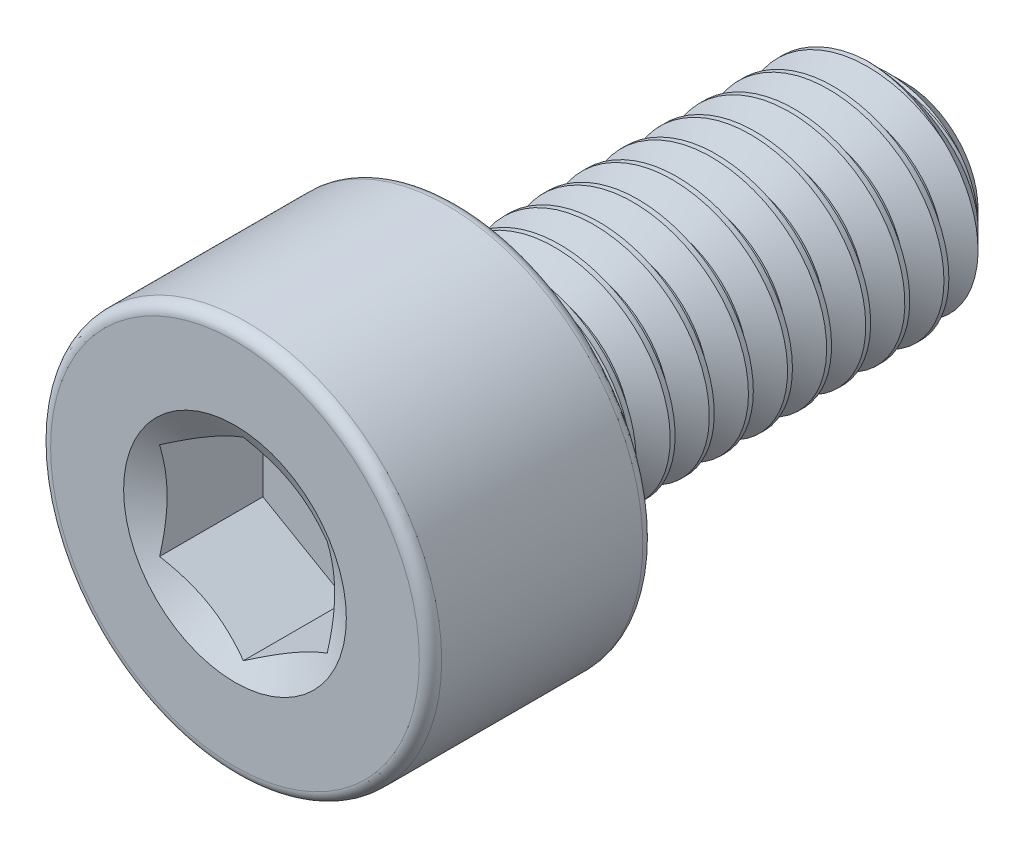
from build123d import *

# Parameters (mm, degrees)
CUT_EXTRUDE1_START            = 6
CUT_EXTRUDE1_DEPTH            = 2
CUT_SWEEP1_PITCH              = 0.7
SKETCH7_R                     = 2.0508
BOSS_EXTRUDE1_DEPTH           = 2.1
BOSS_EXTRUDE1_TAPER           = 20
BOSS_EXTRUDE1_OTHER_WAY_DEPTH = 0.4


# Read off the part's stored shape, not the designer's step: Split1
with BuildPart() as part:
    # Sketch2 → Revolve1 (revolve)
    with BuildSketch(Plane(origin=(0, 0, 0), x_dir=(0, 0, -1), z_dir=(1, 0, 0)), mode=Mode.PRIVATE) as revolve1_sk:
        with BuildLine():
            Line((6, 0), (6, 1.3))
            Line((6, 1.3), (5.3, 2))
            Line((5.3, 2), (-2, 2))
            Line((-2, 2), (-2, 3.3))
            ThreePointArc((-2, 3.3), (-2.058578644, 3.441421356), (-2.2, 3.5))
            Line((-2.2, 3.5), (-5.8, 3.5))
            ThreePointArc((-5.8, 3.5), (-5.941421356, 3.441421356), (-6, 3.3))
            Line((-6, 3.3), (-6, 0))
            Line((-6, 0), (6, 0))
        make_face()
    revolve(revolve1_sk.sketch.rotate(Axis((0, 0, -6), (0, 0, 1)), 90), axis=Axis((0, 0, -6), (0, 0, 1)))

    # Sketch3 → Cut-Extrude1 (cut)
    with BuildSketch(Plane.XY.offset(CUT_EXTRUDE1_START)):
        Polygon((-1.5, 0.866025404), (-1.5, -0.866025404), (0, -1.732050808), (1.5, -0.866025404), (1.5, 0.866025404), (0, 1.732050808), align=None)
    extrude(amount=-CUT_EXTRUDE1_DEPTH, mode=Mode.SUBTRACT)

    # Cut-Extrude2 cone 1 section (through the dimple's axis) → Cut-Extrude2 (revolve, cut)
    with BuildSketch(Plane(origin=(0, 0, 6), x_dir=(0, -1, 0), z_dir=(1, 0, 0))):
        Polygon((0, 0), (1.993375673, 0), (0, 1.150875981), align=None)
    revolve(axis=Axis((0, 0, 6), (0, 0, -1)), mode=Mode.SUBTRACT)


with BuildPart() as body_2:
    # Split1: the piece on the far side of the plane
    add(part.part)
    split(bisect_by=Plane.XY.offset(2), keep=Keep.BOTTOM)

    # Cut-Sweep1: the profile of Sketch5 screwed along a right-hand helix of 12.428571 turns, 6 arcs to a turn; built about Z, then put on its axis
    cut_sweep1_z = Axis((0, 0, 0), (0, 0, 1))
    cut_sweep1_corners = [(1.545336663, 0, -0.2625), (1.545336663, 0, -0.35), (2.037888611, 0, -0.634375), (2.037888611, 0, 0.021875)]
    with BuildLine(mode=Mode.PRIVATE) as cut_sweep1_profile:
        Line(cut_sweep1_corners[0], cut_sweep1_corners[1])
        Line(cut_sweep1_corners[1], cut_sweep1_corners[2])
        Line(cut_sweep1_corners[2], cut_sweep1_corners[3])
        Line(cut_sweep1_corners[3], cut_sweep1_corners[0])
    cut_sweep1_cap = Face(cut_sweep1_profile.wire())
    cut_sweep1_turn_angles = [0, 30, 60, 90, 120, 150, 180, 210, 240, 270, 300, 330, 360]
    cut_sweep1_turn_weights = [1, 0.8660254037844387, 1, 0.8660254037844387, 1, 0.8660254037844387, 1, 0.8660254037844387, 1, 0.8660254037844387, 1, 0.8660254037844387, 1]
    cut_sweep1_turn_rails = [Edge.make_bspline([Vector(p[0], p[1], 0).rotate(cut_sweep1_z, cut_sweep1_turn_angles[k]) / cut_sweep1_turn_weights[k] + Vector(0, 0, p[2] + CUT_SWEEP1_PITCH * cut_sweep1_turn_angles[k] / 360) for k in range(13)], [0, 0, 0, 1, 1, 2, 2, 3, 3, 4, 4, 5, 5, 6, 6, 6], 2, cut_sweep1_turn_weights) for p in cut_sweep1_corners]
    cut_sweep1_turn_sides = [Face.make_surface_from_curves(cut_sweep1_turn_rails[p[0]], cut_sweep1_turn_rails[p[1]]) for p in [(0, 1), (1, 2), (2, 3), (3, 0)]]
    cut_sweep1_last_angles = [4320, 4350, 4380, 4410, 4440, 4457.142857143, 4474.285714286]
    cut_sweep1_last_weights = [1, 0.8660254037844387, 1, 0.8660254037844387, 1, 0.9555728057861514, 1]
    cut_sweep1_last_rails = [Edge.make_bspline([Vector(p[0], p[1], 0).rotate(cut_sweep1_z, cut_sweep1_last_angles[k]) / cut_sweep1_last_weights[k] + Vector(0, 0, p[2] + CUT_SWEEP1_PITCH * cut_sweep1_last_angles[k] / 360) for k in range(7)], [0, 0, 0, 1, 1, 2, 2, 3, 3, 3], 2, cut_sweep1_last_weights) for p in cut_sweep1_corners]
    cut_sweep1_last_sides = [Face.make_surface_from_curves(cut_sweep1_last_rails[p[0]], cut_sweep1_last_rails[p[1]]) for p in [(0, 1), (1, 2), (2, 3), (3, 0)]]
    cut_sweep1 = Plane(origin=(0, 0, -6), x_dir=(0, 1, 0), z_dir=(0, 0, 1)) * Solid(Shell([*[p.moved(Location((0, 0, CUT_SWEEP1_PITCH * i))) for i in range(12) for p in cut_sweep1_turn_sides], *cut_sweep1_last_sides, cut_sweep1_cap, cut_sweep1_cap.rotate(cut_sweep1_z, 4474.285714286).moved(Location((0, 0, CUT_SWEEP1_PITCH * 4474.285714286 / 360)))]))
    add(cut_sweep1, mode=Mode.SUBTRACT)


with BuildPart() as part_1:
    add(part.part)

    # Split1
    split(bisect_by=Plane.XY.offset(2), keep=Keep.TOP)

    add(body_2.part)  # Boss-Extrude1 merges body 2
    # Sketch7 → Boss-Extrude1 (add)
    with BuildSketch(Plane(origin=(0, 0, 2), x_dir=(-1, 0, 0), z_dir=(0, 0, -1))):
        Circle(SKETCH7_R)
    extrude(amount=BOSS_EXTRUDE1_DEPTH, taper=BOSS_EXTRUDE1_TAPER)

    # Sketch7 → Boss-Extrude1 other way (add)
    with BuildSketch(Plane(origin=(0, 0, 2), x_dir=(-1, 0, 0), z_dir=(0, 0, -1))):
        Circle(SKETCH7_R)
    extrude(amount=-BOSS_EXTRUDE1_OTHER_WAY_DEPTH)


solid = part_1.part
